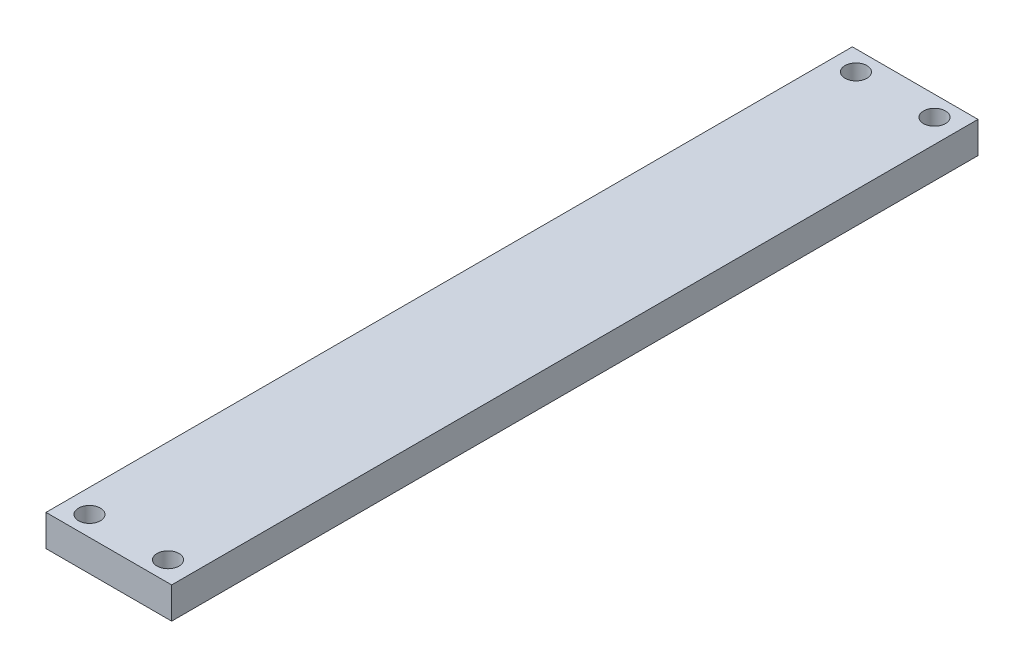
from build123d import *

# Parameters (mm, degrees)
SKETCH1_W           = 20
SKETCH1_H           = 5
BOSS_EXTRUDE1_DEPTH = 64.175
SKETCH2_R           = 1.75
CUT_EXTRUDE1_DEPTH  = 66.14161976


with BuildPart() as part:
    # Sketch1 → Boss-Extrude1 (new, symmetric)
    with BuildSketch(Plane.XY):
        Rectangle(SKETCH1_W, SKETCH1_H)
    extrude(amount=BOSS_EXTRUDE1_DEPTH, both=True)

    # Sketch2 → Cut-Extrude1 (cut, through all)
    with BuildSketch(Plane(origin=(0, 2.5, 0), x_dir=(1, 0, 0), z_dir=(0, 1, 0))):
        with Locations((-6.25, -61)):
            Circle(SKETCH2_R)
        with Locations((6.25, -61)):
            Circle(SKETCH2_R)
        with Locations((6.25, 61)):
            Circle(SKETCH2_R)
        with Locations((-6.25, 61)):
            Circle(SKETCH2_R)
    extrude(amount=-CUT_EXTRUDE1_DEPTH, mode=Mode.SUBTRACT)


solid = part.part
